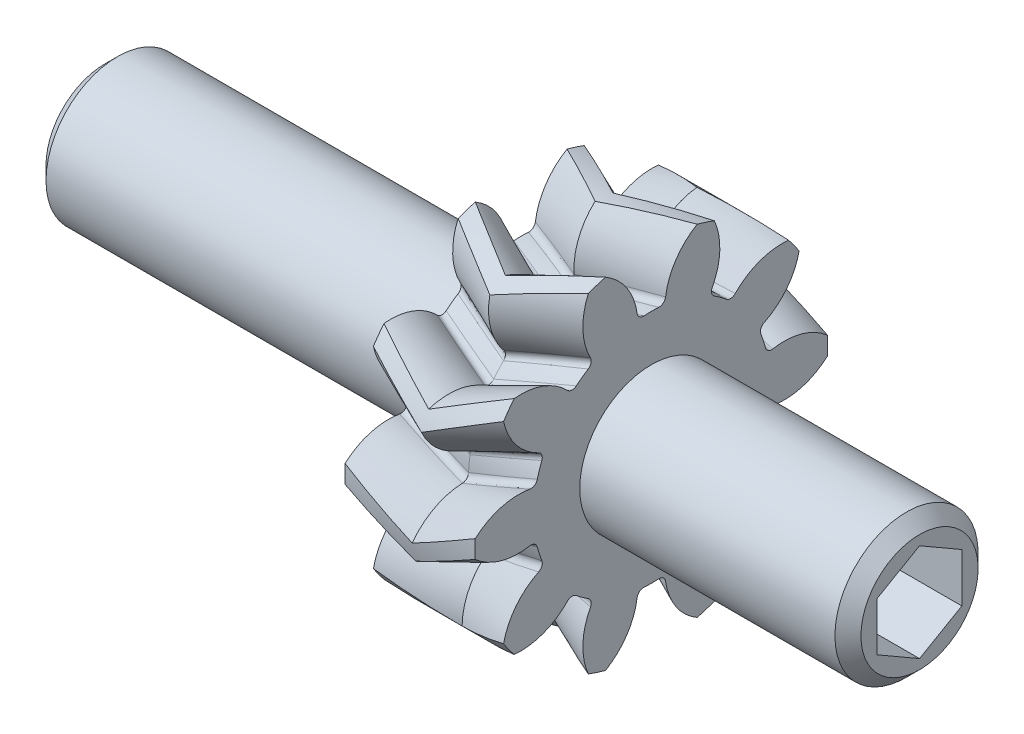
from build123d import *

# Parameters (mm, degrees)
BASPROSKE_W             = 5
BASPROSKE_H             = 13.547005384
TOOTHCUTRH_PITCH        = 147.429298514
TOOTHCUTRH_HEIGHT       = 5
TOOTHCUTRH_RADIUS       = 13.547005384
TOOTHCUTRH_START_ANGLE  = -90
TEETHCUTSRH_COUNT       = 10
BORSKE_R                = 5.5
BORE_DEPTH              = 62.5000025
BOSS_EXTRU_1_DEPTH      = 32
BOSS_EXTRU_1_DEPTH_BACK = 30.6
ESQUISSE1_R             = 5.5
ENL_V_MAT_EXTRU_1_DEPTH = 14
CHANFREIN1_SIZE         = 1
ENL_V_MAT_EXTRU_2_DEPTH = 14
CHANFREIN2_SIZE         = 1


with BuildPart() as part:
    # BasProSke → Base-Revolve (revolve)
    with BuildSketch(Plane(origin=(0, 0, 0), x_dir=(1, 0, 0), z_dir=(0, 1, 0)), mode=Mode.PRIVATE) as base_revolve_sk:
        with Locations((2.5, 6.773502692)):
            Rectangle(BASPROSKE_W, BASPROSKE_H)
    revolve(base_revolve_sk.sketch.rotate(Axis((-10, 0, 0), (1, 0, 0)), 180), axis=Axis((-10, 0, 0), (1, 0, 0)))

    # ToothCutRH: sweep along a helix
    with BuildLine() as toothcutrh_path:
        add(Helix(TOOTHCUTRH_PITCH, TOOTHCUTRH_HEIGHT, TOOTHCUTRH_RADIUS, center=(0, 0, 0), direction=(1, 0, 0), mode=Mode.PRIVATE).rotate(Axis((0, 0, 0), (1, 0, 0)), TOOTHCUTRH_START_ANGLE))
    # TooCutSkeRH → ToothCutRH (sweep, cut)
    with BuildSketch(Plane(origin=(0, 0, 0), x_dir=(0, 0, -1), z_dir=(1, 0, 0))):
        with BuildLine():
            ThreePointArc((0.56474538, 9.029361498), (0, 9.047005384), (-0.56474538, 9.029361498))
            ThreePointArc((-0.56474538, 9.029361498), (-0.912719018, 9.141180308), (-1.092137157, 9.459611196))
            ThreePointArc((-1.092137157, 9.459611196), (-2.065450401, 11.792434954), (-4.055435717, 13.351076606))
            ThreePointArc((-4.055435717, 13.351076606), (0, 13.953415545), (4.055435717, 13.351076606))
            ThreePointArc((4.055435717, 13.351076606), (2.065450401, 11.792434954), (1.092137157, 9.459611196))
            ThreePointArc((1.092137157, 9.459611196), (0.912719018, 9.141180308), (0.56474538, 9.029361498))
        make_face()
    toothcutrh = sweep(path=toothcutrh_path.line, is_frenet=True, mode=Mode.SUBTRACT)

    # TeethCutsRH: ToothCutRH ×10 about axis
    teethcutsrh_axis = Axis((-10, 0, 0), (1, 0, 0))
    for i in range(1, TEETHCUTSRH_COUNT):
        add(toothcutrh.rotate(teethcutsrh_axis, i * 360 / TEETHCUTSRH_COUNT), mode=Mode.SUBTRACT)

    # BorSke → Bore (cut, symmetric)
    with BuildSketch(Plane(origin=(0, 0, 0), x_dir=(0, 0, -1), z_dir=(1, 0, 0))):
        with Locations(Location((0, 0, 0), (0, 0, 180))):
            Circle(BORSKE_R)
    extrude(amount=BORE_DEPTH, both=True, mode=Mode.SUBTRACT)

    # Symétrie1: part across plane


with BuildPart() as part_1:
    add(part.part)
    add(part.part.mirror(Plane.ZY.offset(-5)))

    # Esquisse1 → Boss.-Extru.1 (add, two sides: drawn at the far end of the back side and taken through both)
    with BuildSketch(Plane(origin=(0, 0, 0), x_dir=(0, -1, 0), z_dir=(-1, 0, 0)).offset(-BOSS_EXTRU_1_DEPTH_BACK)):
        with Locations(Location((0, 0, 0), (0, 0, 90))):
            Circle(ESQUISSE1_R)
    extrude(amount=BOSS_EXTRU_1_DEPTH + BOSS_EXTRU_1_DEPTH_BACK)

    # Esquisse2 → Enlèv. mat.-Extru.1 (cut)
    with BuildSketch(Plane.YZ.offset(30.6)):
        Polygon((-1.876388375, -3.25), (1.876388375, -3.25), (3.75277675, 0), (1.876388375, 3.25), (-1.876388375, 3.25), (-3.75277675, 0), align=None)
    extrude(amount=-ENL_V_MAT_EXTRU_1_DEPTH, mode=Mode.SUBTRACT)

    # Chanfrein1
    chanfrein1_edges = [part_1.edges().sort_by_distance(p)[0] for p in [
        (30.6, 0, -5.5),
    ]]
    chamfer(chanfrein1_edges, length=CHANFREIN1_SIZE)

    # Esquisse3 → Enlèv. mat.-Extru.2 (cut)
    with BuildSketch(Plane.ZY.offset(32)):
        Polygon((0, -3.75277675), (3.25, -1.876388375), (3.25, 1.876388375), (0, 3.75277675), (-3.25, 1.876388375), (-3.25, -1.876388375), align=None)
    extrude(amount=-ENL_V_MAT_EXTRU_2_DEPTH, mode=Mode.SUBTRACT)

    # Chanfrein2
    chanfrein2_edges = [part_1.edges().sort_by_distance(p)[0] for p in [
        (-32, 0, -5.5),
    ]]
    chamfer(chanfrein2_edges, length=CHANFREIN2_SIZE)


solid = part_1.part
